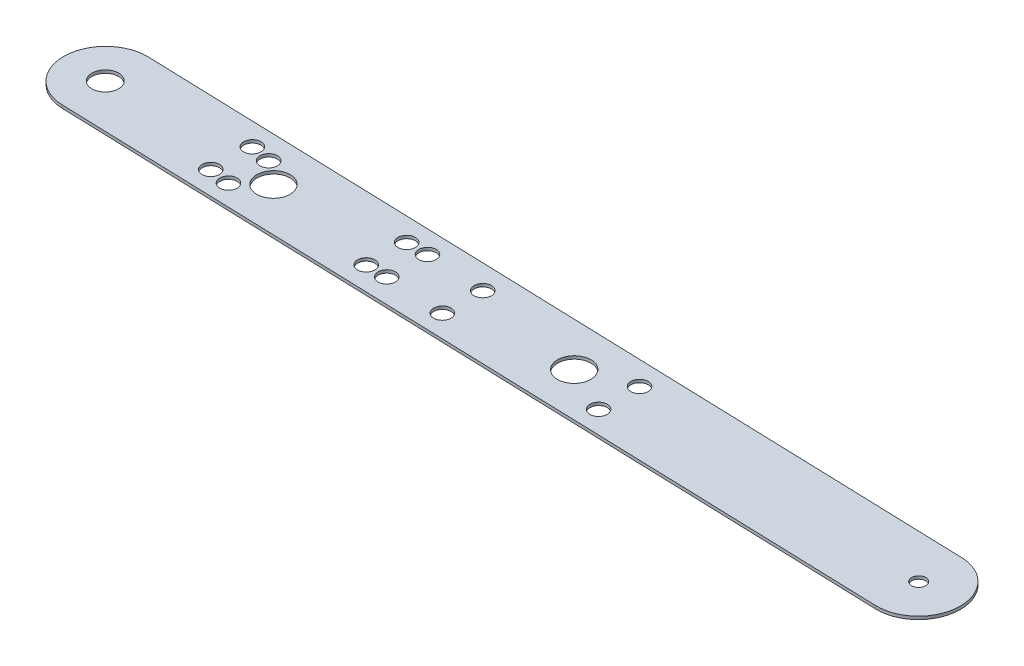
from build123d import *

# Parameters (mm, degrees)
BASE_FLANGE1_DEPTH          = 0.9
SKETCH7_R                   = 1.75
CUT_EXTRUDE1_DEPTH          = 10
F_6_0_204_DIAMETER_SLOT1_D  = 5.1816
F_1_0MM_DOWEL_SLOT1_D       = 8
F_19_0_166_DIAMETER_SLOT2_D = 4.2164
F_10_0MM_DOWEL_SLOT1_D      = 10
F_6_0_204_DIAMETER_SLOT7_D  = 5.1816
F_6_0_204_DIAMETER_SLOT9_D  = 5.1816
F_6_0_204_DIAMETER_SLOT10_D = 5.1816
BODY_MOVE_COPY1_ANGLE       = 90
BODY_MOVE_COPY2_ANGLE       = 14.508572097
F_6_0_204_DIAMETER_SLOT11_D = 5.1816


# Sheet-metal steps are written as plain solids
with BuildPart() as part:
    # Sketch1 → Base-Flange1 (new body)
    with BuildSketch(Plane.XY):
        with BuildLine():
            Line((-82.128696711, 43.701330638), (157.948038639, 113.437699511))
            ThreePointArc((157.948038639, 113.437699511), (173.43869385, 104.920681188), (164.921675527, 89.430025976))
            Line((164.921675527, 89.430025976), (-75.155059823, 19.693657103))
            ThreePointArc((-75.155059823, 19.693657103), (-90.645715035, 28.210675427), (-82.128696711, 43.701330638))
        make_face()
    extrude(amount=-BASE_FLANGE1_DEPTH)

    # Sketch7 → Cut-Extrude1 (cut)
    with BuildSketch(Plane.XY):
        with Locations((-78.641878267, 31.69749387)):
            Circle(SKETCH7_R)
    extrude(amount=-CUT_EXTRUDE1_DEPTH, mode=Mode.SUBTRACT)

    # #6 (0.204) Diameter Slot1 (through all)
    with Locations(Plane.XY):
        with Locations((-34.211526563, 39.252388593)):
            Hole(F_6_0_204_DIAMETER_SLOT1_D / 2)

    # Ø1.0mm Dowel Slot1 (through all)
    with Locations(Plane.XY):
        with Locations((-78.641878267, 31.69749387)):
            Hole(F_1_0MM_DOWEL_SLOT1_D / 2)

    # #19 (0.166) Diameter Slot2 (through all)
    with Locations(Plane.XY):
        with Locations((161.434857083, 101.433862744)):
            Hole(F_19_0_166_DIAMETER_SLOT2_D / 2)

    # Ø10.0mm Dowel Slot1 (through all)
    with Locations(Plane(origin=(0, 0, -0.9), x_dir=(-1, 0, 0), z_dir=(0, 0, -1))):
        with Locations((28.994009397, 46.118974953), (-59.756909092, 71.89892727)):
            Hole(F_10_0MM_DOWEL_SLOT1_D / 2)

    # #6 (0.204) Diameter Slot7 (through all)
    with Locations(Plane(origin=(0, 0, -0.9), x_dir=(-1, 0, 0), z_dir=(0, 0, -1))):
        with Locations((37.45422118, 50.452838291)):
            Hole(F_6_0_204_DIAMETER_SLOT7_D / 2)

    # #6 (0.204) Diameter Slot9 (through all)
    with Locations(Plane.XY):
        with Locations((28.62233158, 56.99969603), (25.374397473, 68.28544764), (74.772604857, 70.247325472), (71.479014493, 81.687286544)):
            Hole(F_6_0_204_DIAMETER_SLOT9_D / 2)

    # #6 (0.204) Diameter Slot10 (through all)
    with Locations(Plane(origin=(0, 0, -0.9), x_dir=(-1, 0, 0), z_dir=(0, 0, -1))):
        with Locations((-8.595334372, 62.898097763), (-11.911821865, 51.602538742)):
            Hole(F_6_0_204_DIAMETER_SLOT10_D / 2)


with BuildPart() as part_1:
    # Body-Move/Copy1: moved
    add(part.part.rotate(Axis((0, 66.565678307, -0.45), (1, 0, 0)), BODY_MOVE_COPY1_ANGLE))


with BuildPart() as part_2:
    # Body-Move/Copy2: moved
    add(part_1.part.moved(Location((0, 0, 0))).rotate(Axis((39.067388507, -1.340632846, -0.153700941), (0.03427825712896061, 0.9994028141797792, -0.004360745089880855)), BODY_MOVE_COPY2_ANGLE))

    # #6 (0.204) Diameter Slot11 (through all)
    with Locations(Plane(origin=(0.144643233, 66.197270405, 0.559293884), x_dir=(-0.9999976129939137, 0.0021848720127792104, 1.845975741503872e-05), z_dir=(-0.002184949993677132, -0.999961923064164, -0.00844857475223902))):
        with Locations((-2.433159338, -3.616580433), (-2.759003314, 8.103849751), (45.263549296, -2.25659234), (44.813996852, 9.677370774)):
            Hole(F_6_0_204_DIAMETER_SLOT11_D / 2)


solid = part_2.part
